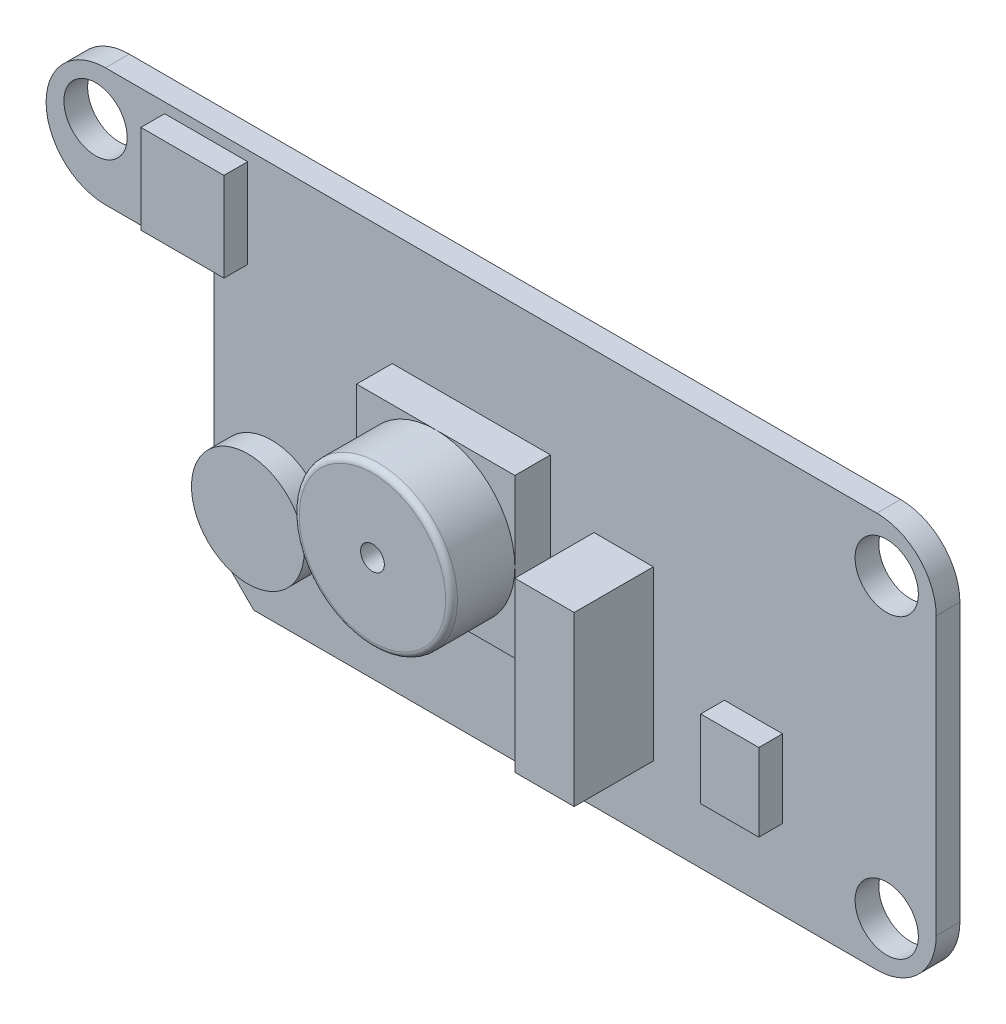
from build123d import *

# Parameters (mm, degrees)
SKETCH1_R           = 1.6
BOSS_EXTRUDE1_DEPTH = 1.2
SKETCH2_R           = 2.85
SKETCH2_W           = 2.937952631
SKETCH2_H           = 3.927283648
SKETCH2_W_2         = 4.2
SKETCH2_H_2         = 4.5
BOSS_EXTRUDE2_DEPTH = 1.2
SKETCH3_W           = 8
SKETCH3_H           = 8
BOSS_EXTRUDE3_DEPTH = 1.8
SKETCH4_R           = 4
BOSS_EXTRUDE4_DEPTH = 3.2
SKETCH5_R           = 0.6
CUT_EXTRUDE1_DEPTH  = 1
SKETCH7_W           = 7
SKETCH7_H           = 7
SKETCH7_W_2         = 3.728136851
SKETCH7_H_2         = 1.761566417
SKETCH7_H_3         = 1.704612402
SKETCH7_W_3         = 3.603269321
SKETCH7_H_4         = 1.768357774
SKETCH7_W_4         = 3.352143609
SKETCH7_H_5         = 1.732407439
SKETCH7_W_5         = 1.212415991
SKETCH7_H_6         = 2.614149225
SKETCH7_W_6         = 2.309899449
SKETCH7_H_7         = 0.895937988
SKETCH7_W_7         = 2.468868555
SKETCH7_H_8         = 1.120250043
SKETCH7_H_9         = 0.966414447
BOSS_EXTRUDE5_DEPTH = 1.2
SKETCH8_W           = 3
SKETCH8_H           = 8.5
BOSS_EXTRUDE6_DEPTH = 4
FILLET1_R           = 0.3
FILLET2_R           = 3
CHAMFER1_SIZE       = 2


with BuildPart() as part:
    # Sketch1 → Boss-Extrude1 (new body)
    with BuildSketch(Plane.XY):
        Polygon((0, 20), (-8.5, 20), (-8.5, 14), (0, 14), (0, 0), (36.5, 0), (36.5, 20), align=None)
        with Locations((-6, 17.5)):
            Circle(SKETCH1_R, mode=Mode.SUBTRACT)
        with Locations((34, 2.5)):
            Circle(SKETCH1_R, mode=Mode.SUBTRACT)
        with Locations((34, 17.5)):
            Circle(SKETCH1_R, mode=Mode.SUBTRACT)
    extrude(amount=BOSS_EXTRUDE1_DEPTH)

    # Sketch2 → Boss-Extrude2 (add)
    with BuildSketch(Plane.XY.offset(1.2)):
        with Locations((2.9, 5.049940133)):
            Circle(SKETCH2_R)
        with Locations((27.263972555, 5.991759132)):
            Rectangle(SKETCH2_W, SKETCH2_H)
        with Locations((-0.408107806, 17.235427956)):
            Rectangle(SKETCH2_W_2, SKETCH2_H_2)
    extrude(amount=BOSS_EXTRUDE2_DEPTH)

    # Sketch3 → Boss-Extrude3 (add)
    with BuildSketch(Plane.XY.offset(1.2)):
        with Locations((13, 10.3)):
            Rectangle(SKETCH3_W, SKETCH3_H)
    extrude(amount=BOSS_EXTRUDE3_DEPTH)

    # Sketch4 → Boss-Extrude4 (add)
    with BuildSketch(Plane.XY.offset(3)):
        with Locations((13, 10.3)):
            Circle(SKETCH4_R)
    extrude(amount=BOSS_EXTRUDE4_DEPTH)

    # Sketch5 → Cut-Extrude1 (cut)
    with BuildSketch(Plane.XY.offset(6.2)):
        with Locations((13, 10.3)):
            Circle(SKETCH5_R)
    extrude(amount=-CUT_EXTRUDE1_DEPTH, mode=Mode.SUBTRACT)

    # Sketch7 → Boss-Extrude5 (add)
    with BuildSketch(Plane(origin=(0, 0, 0), x_dir=(-1, 0, 0), z_dir=(0, 0, -1))):
        with Locations((-10.5, 11)):
            Rectangle(SKETCH7_W, SKETCH7_H)
        with Locations((-21.140690462, 1.973810546)):
            Rectangle(SKETCH7_W_2, SKETCH7_H_2)
        with Locations((-21.140690462, 4.459014526)):
            Rectangle(SKETCH7_W_2, SKETCH7_H_3)
        with Locations((-19.339055802, 16.82217617)):
            Rectangle(SKETCH7_W_3, SKETCH7_H_4)
        with Locations((-6.335774559, 4.965027996)):
            Rectangle(SKETCH7_W_4, SKETCH7_H_5)
        with Locations((0.606207996, 17.481290904)):
            Rectangle(SKETCH7_W_5, SKETCH7_H_6)
        with Locations((-18.692370866, 14.947968994)):
            Rectangle(SKETCH7_W_6, SKETCH7_H_7)
        with Locations((-25.431234808, 4.404902976)):
            Rectangle(SKETCH7_W_7, SKETCH7_H_8)
        with Locations((-25.431234808, 1.951905582)):
            Rectangle(SKETCH7_W_7, SKETCH7_H_9)
    extrude(amount=BOSS_EXTRUDE5_DEPTH)

    # Sketch8 → Boss-Extrude6 (add)
    with BuildSketch(Plane.XY.offset(1.2)):
        with Locations((20.7, 7.75)):
            Rectangle(SKETCH8_W, SKETCH8_H)
    extrude(amount=BOSS_EXTRUDE6_DEPTH)

    # Fillet1
    fillet1_edges = [part.edges().sort_by_distance(p)[0] for p in [
        (9, 10.3, 6.2),
    ]]
    fillet(fillet1_edges, radius=FILLET1_R)

    # Fillet2
    fillet2_edges = [part.edges().sort_by_distance(p)[0] for p in [
        (36.5, 20, 0.6),
        (36.5, 0, 0.6),
        (-8.5, 14, 0.6),
        (-8.5, 20, 0.6),
    ]]
    fillet(fillet2_edges, radius=FILLET2_R - 0.0001)  # a hair under: the kernel refuses the full size

    # Chamfer1
    chamfer1_edges = [part.edges().sort_by_distance(p)[0] for p in [
        (0, 0, 0.6),
    ]]
    chamfer(chamfer1_edges, length=CHAMFER1_SIZE)


solid = part.part
